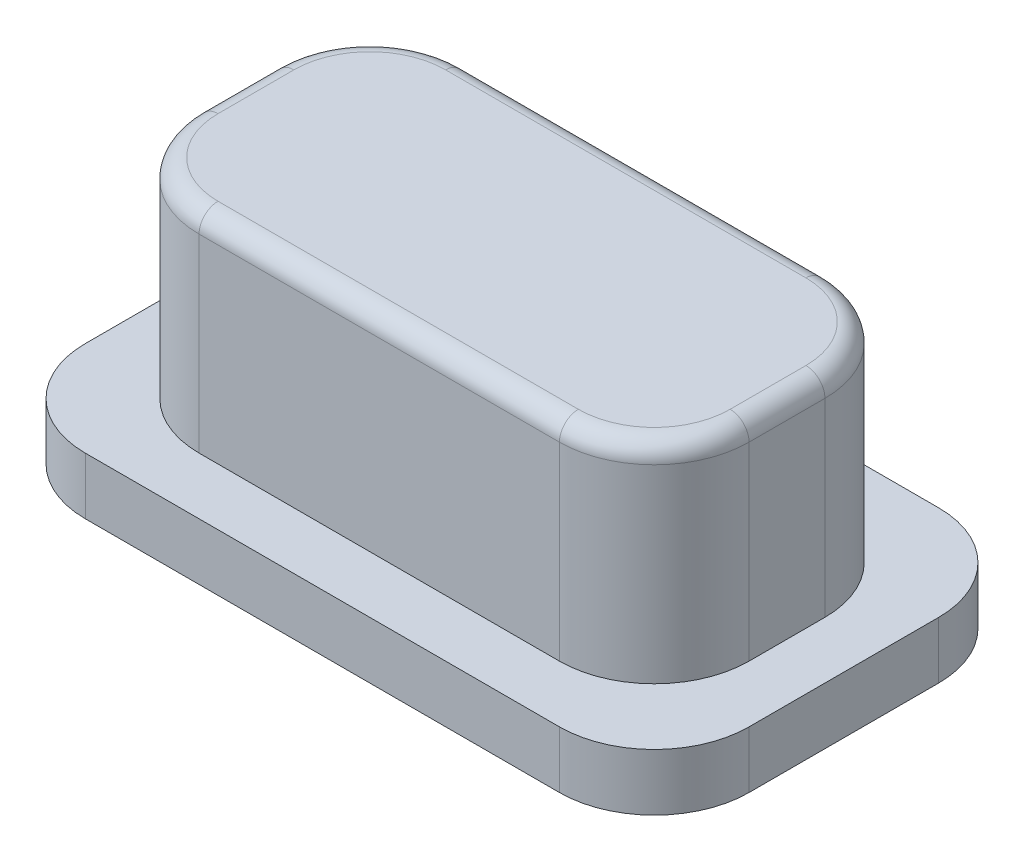
from build123d import *

# Parameters (mm, degrees)
SKETCH_1_W      = 7
SKETCH_1_H      = 4
EXTRUDE_1_DEPTH = 0.6
SKETCH_2_W      = 5.8
SKETCH_2_H      = 2.8
EXTRUDE_2_DEPTH = 2.2
FILLET_1_R      = 1
SKETCH_3_W      = 3
SKETCH_3_H      = 1.6
EXTRUDE_3_DEPTH = 0.1
FILLET_2_R      = 0.2


with BuildPart() as part:
    # 草图1 → 凸台-拉伸1 (new body)
    with BuildSketch(Plane(origin=(0, 0, 0), x_dir=(1, 0, 0), z_dir=(0, 1, 0))):
        with Locations((0.996893044, -0.239645207)):
            Rectangle(SKETCH_1_W, SKETCH_1_H)
    extrude(amount=EXTRUDE_1_DEPTH)

    # 草图2 → 凸台-拉伸2 (add)
    with BuildSketch(Plane(origin=(0, 0.6, 0), x_dir=(1, 0, 0), z_dir=(0, 1, 0))):
        with Locations((0.996893044, -0.239645207)):
            Rectangle(SKETCH_2_W, SKETCH_2_H)
    extrude(amount=EXTRUDE_2_DEPTH)

    # 圆角1
    fillet_1_edges = [part.edges().sort_by_distance(p)[0] for p in [
        (4.496893044, 0.3, -1.760354793),
        (4.496893044, 0.3, 2.239645207),
        (-2.503106956, 0.3, -1.760354793),
        (-2.503106956, 0.3, 2.239645207),
        (3.896893044, 1.7, -1.160354793),
        (-1.903106956, 1.7, -1.160354793),
        (-1.903106956, 1.7, 1.639645207),
        (3.896893044, 1.7, 1.639645207),
    ]]
    fillet(fillet_1_edges, radius=FILLET_1_R)

    # 草图3 → 凸台-拉伸3 (add)
    with BuildSketch(Plane(origin=(0, 0, 0), x_dir=(-1, 0, 0), z_dir=(0, -1, 0))):
        with Locations((-0.996893044, -0.239645207)):
            Rectangle(SKETCH_3_W, SKETCH_3_H)
    extrude(amount=EXTRUDE_3_DEPTH)

    # 圆角2
    fillet_2_edges = [part.edges().sort_by_distance(p)[0] for p in [
        (3.603999825, 2.8, -0.867461574),
        (3.603999825, 2.8, 1.346751988),
        (0.996893044, 2.8, 1.639645207),
        (-1.610213737, 2.8, 1.346751988),
        (-1.610213737, 2.8, -0.867461574),
        (0.996893044, 2.8, -1.160354793),
        (-1.903106956, 2.8, 0.239645207),
        (3.896893044, 2.8, 0.239645207),
    ]]
    fillet(fillet_2_edges, radius=FILLET_2_R)


solid = part.part
